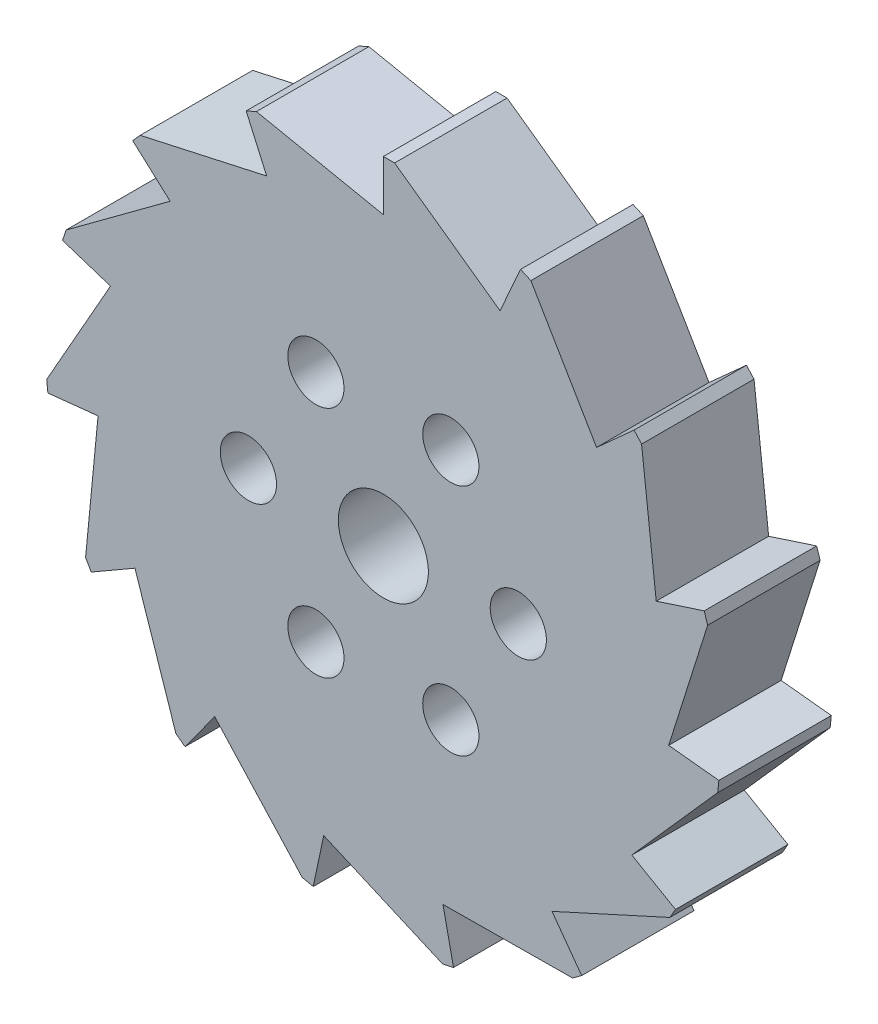
from build123d import *

# Parameters (mm, degrees)
BOSS_EXTRUDE2_DEPTH = 10
SKETCH2_R           = 4
SKETCH2_R_2         = 2.5
CUT_EXTRUDE1_DEPTH  = 10


with BuildPart() as part:
    # Sketch1 → Boss-Extrude2 (new body)
    with BuildSketch(Plane.XY):
        Polygon((0, 25.51264103), (0, 30), (1.000891574, 30), (10.376925968, 23.306957325), (12.202099292, 27.406363729), (13.116459243, 26.99926445), (18.959587166, 17.071288962), (22.294344764, 20.073918191), (22.96407195, 19.330110797), (24.263963499, 7.88383965), (28.531695489, 9.270509831), (28.840987995, 8.318605378), (25.372880113, -2.666797161), (29.835656861, -3.135853898), (29.731035203, -4.131262483), (22.094595249, -12.756320515), (25.980762114, -15), (25.480316326, -15.86679753), (14.995954144, -20.640160164), (17.633557569, -24.270509831), (16.823819276, -24.858819138), (5.304376334, -24.955128612), (6.237350725, -29.344428022), (5.258331033, -29.552525082), (-5.304376334, -24.955128612), (-6.237350725, -29.344428022), (-7.216370416, -29.136330963), (-14.995954144, -20.640160164), (-17.633557569, -24.270509831), (-18.443295862, -23.682200525), (-22.094595249, -12.756320515), (-25.980762114, -15), (-26.481207901, -14.13320247), (-25.372880113, -2.666797161), (-29.835656861, -3.135853898), (-29.940278519, -2.140445313), (-24.263963499, 7.88383965), (-28.531695489, 9.270509831), (-28.222402983, 10.222414285), (-18.959587165, 17.071288962), (-22.294344764, 20.073918191), (-21.624617578, 20.817725585), (-10.376925968, 23.306957325), (-12.202099292, 27.406363729), (-11.287739341, 27.813463008), align=None)
    extrude(amount=BOSS_EXTRUDE2_DEPTH)

    # Sketch2 → Cut-Extrude1 (cut)
    with BuildSketch(Plane(origin=(0, 0, 0), x_dir=(-1, 0, 0), z_dir=(0, 0, -1))):
        Circle(SKETCH2_R)
        with Locations((-12, 0)):
            Circle(SKETCH2_R_2)
        with Locations((-6, 10.392304845)):
            Circle(SKETCH2_R_2)
        with Locations((6, 10.392304845)):
            Circle(SKETCH2_R_2)
        with Locations((12, 0)):
            Circle(SKETCH2_R_2)
        with Locations((6, -10.392304845)):
            Circle(SKETCH2_R_2)
        with Locations((-6, -10.392304845)):
            Circle(SKETCH2_R_2)
    extrude(amount=-CUT_EXTRUDE1_DEPTH, mode=Mode.SUBTRACT)


solid = part.part
